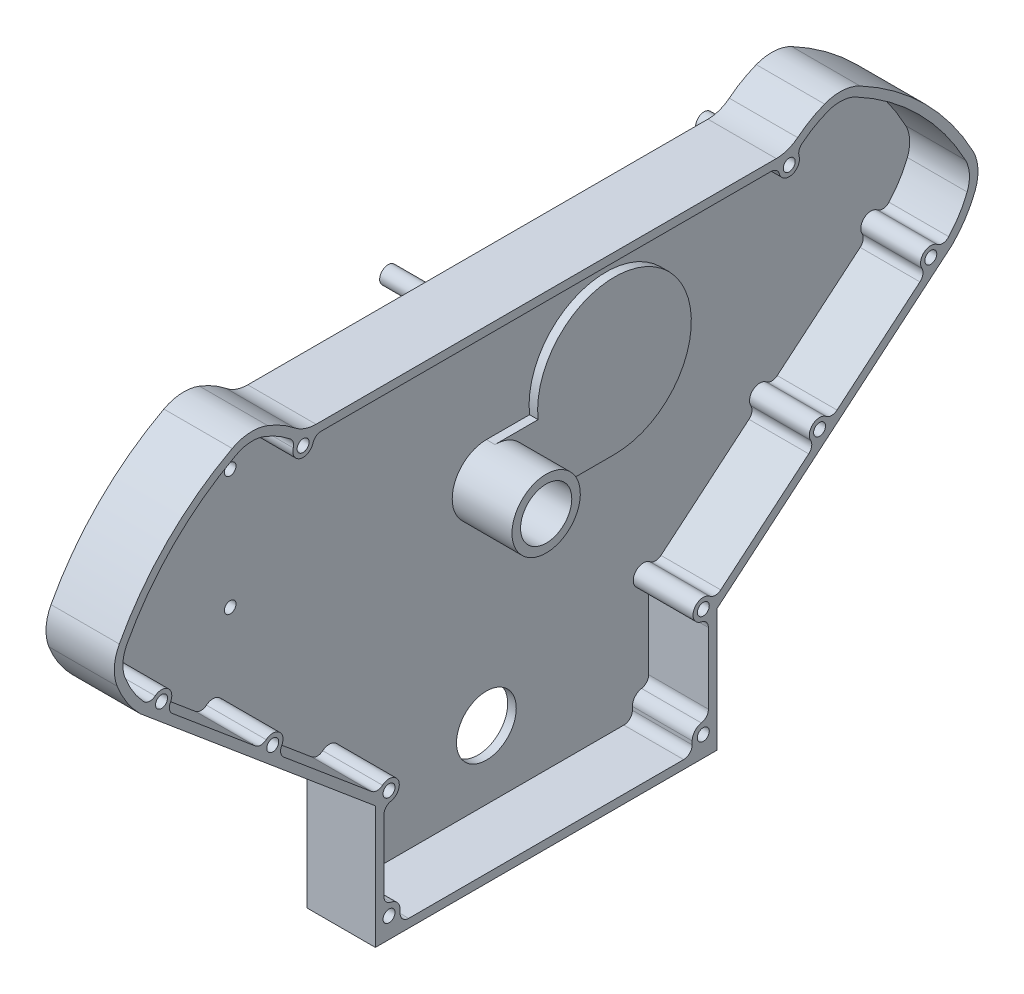
from build123d import *

# Parameters (mm, degrees)
BOSS_EXTRUDE1_DEPTH           = 20
BOSS_EXTRUDE1_DEPTH_BACK      = 20
SKETCH1_R                     = 15
FILLET2_R                     = 20
CUT_EXTRUDE3_DEPTH            = 5
SHELL1_START                  = -15
SHELL1_DEPTH                  = 35
SHELL1_START_2                = -10
SHELL1_2_DEPTH                = 30
SKETCH2_R                     = 17.5
CUT_EXTRUDE1_DEPTH            = 359.139425448
BOSS_EXTRUDE2_DEPTH           = 20
BOSS_EXTRUDE2_DEPTH_BACK      = 20
SKETCH4_R                     = 6
SKETCH4_R_2                   = 6.5
SKETCH5_R                     = 3.5
CUT_EXTRUDE2_DEPTH            = 360.810850393
FILLET3_R                     = 5
SKETCH9_R                     = 22.5
CUT_EXTRUDE5_DEPTH            = 2.5
SKETCH10_R                    = 3.5
BOSS_EXTRUDE3_DEPTH           = 37.5
FILLET4_R                     = 5
SKETCH11_R                    = 17.5
BOSS_EXTRUDE4_DEPTH           = 20
BOSS_EXTRUDE4_DRAFT           = 15
BOSS_EXTRUDE4_PROFILE_2_DEPTH = 20
BOSS_EXTRUDE4_PROFILE_2_DRAFT = 15
BOSS_EXTRUDE4_PROFILE_3_DEPTH = 20
BOSS_EXTRUDE4_PROFILE_3_DRAFT = 15
BOSS_EXTRUDE4_PROFILE_4_DEPTH = 20
BOSS_EXTRUDE4_PROFILE_4_DRAFT = 15
SKETCH12_R                    = 5
BOSS_EXTRUDE5_DEPTH           = 35
BOSS_EXTRUDE6_DEPTH           = 5
TAP_DRILL_FOR_M8_TAP1_D       = 6.8
TAP_DRILL_FOR_M8_TAP1_DEPTH   = 20
TAP_DRILL_FOR_M8_TAP1_TIP     = 2.042926105


# Read off the part's stored shape, not the designer's step: Shell1
with BuildPart() as part:
    # Sketch1 → Boss-Extrude1 (new, two sides: drawn at the far end of the back side and taken through both)
    with BuildSketch(Plane(origin=(0, 0, 0), x_dir=(0, 0, -1), z_dir=(1, 0, 0)).offset(-BOSS_EXTRUDE1_DEPTH_BACK)):
        with BuildLine():
            Line((-100, -45), (100, -45))
            Line((100, -45), (100, 26.817942396))
            Line((100, 26.817942396), (172.53405461, 87.681240867))
            Line((172.53405461, 87.681240867), (237.647832275, 142.31818769))
            ThreePointArc((237.647832275, 142.31818769), (245.477912651, 151.968299934), (251.152061969, 163.024468102))
            ThreePointArc((251.152061969, 163.024468102), (252.803738513, 173.555281136), (249.918352274, 183.816889432))
            ThreePointArc((249.918352274, 183.816889432), (221.802815136, 221.802815136), (183.816889432, 249.918352274))
            ThreePointArc((183.816889432, 249.918352274), (173.555281136, 252.803738513), (163.024468102, 251.152061969))
            ThreePointArc((163.024468102, 251.152061969), (151.968299934, 245.477912651), (142.31818769, 237.647832275))
            Line((142.31818769, 237.647832275), (-142.31818769, 237.647832275))
            ThreePointArc((-142.31818769, 237.647832275), (-151.968299934, 245.477912651), (-163.024468102, 251.152061969))
            ThreePointArc((-163.024468102, 251.152061969), (-173.555281136, 252.803738513), (-183.816889432, 249.918352274))
            ThreePointArc((-183.816889432, 249.918352274), (-221.802815136, 221.802815136), (-249.918352274, 183.816889432))
            ThreePointArc((-249.918352274, 183.816889432), (-252.803738513, 173.555281136), (-251.152061969, 163.024468102))
            ThreePointArc((-251.152061969, 163.024468102), (-245.477912651, 151.968299934), (-237.647832275, 142.31818769))
            Line((-237.647832275, 142.31818769), (-172.53405461, 87.681240867))
            Line((-172.53405461, 87.681240867), (-100, 26.817942396))
            Line((-100, 26.817942396), (-100, -45))
        make_face()
        with Locations((0, 125)):
            Circle(SKETCH1_R, mode=Mode.SUBTRACT)
    extrude(amount=BOSS_EXTRUDE1_DEPTH + BOSS_EXTRUDE1_DEPTH_BACK)

    # Fillet2
    fillet2_edges = [part.edges().sort_by_distance(p)[0] for p in [
        (0, 237.647832275, 142.31818769),
        (0, 237.647832275, -142.31818769),
    ]]
    fillet(fillet2_edges, radius=FILLET2_R)

    # Sketch6 → Cut-Extrude3 (cut)
    with BuildSketch(Plane.ZY.offset(20)):
        with BuildLine():
            Line((0, 110), (-70, 110))
            ThreePointArc((-70, 110), (-94.494897428, 181.622776602), (-31.270166538, 140))
            Line((-31.270166538, 140), (0, 140))
            ThreePointArc((0, 140), (15, 125), (0, 110))
        make_face()
    extrude(amount=-CUT_EXTRUDE3_DEPTH, mode=Mode.SUBTRACT)

    # Shell1 outline → Shell1 (cut)
    with BuildSketch(Plane.YZ.offset(SHELL1_START)):
        with BuildLine():
            ThreePointArc((181.468415704, 245.504207832), (173.259129067, 247.812516824), (164.83447864, 246.491175588))
            ThreePointArc((164.83447864, 246.491175588), (154.789156657, 241.348117675), (146.005028308, 234.263018692))
            Line((146.005028308, 234.263018692), (29.149480687, 95))
            Line((29.149480687, 95), (-40, 95))
            Line((-40, 95), (-40, -95))
            Line((-40, -95), (29.149480687, -95))
            Line((29.149480687, -95), (146.005028308, -234.263018692))
            ThreePointArc((146.005028308, -234.263018692), (154.789156657, -241.348117675), (164.83447864, -246.491175588))
            ThreePointArc((164.83447864, -246.491175588), (173.259129067, -247.812516824), (181.468415704, -245.504207832))
            ThreePointArc((181.468415704, -245.504207832), (218.26728123, -218.26728123), (245.504207832, -181.468415704))
            ThreePointArc((245.504207832, -181.468415704), (247.812516824, -173.259129067), (246.491175588, -164.83447864))
            ThreePointArc((246.491175588, -164.83447864), (242.869038207, -157.272699939), (238.139580127, -150.349362405))
            ThreePointArc((238.139580127, -150.349362405), (234.060692731, -143.000505321), (232.647832275, -134.715165971))
            Line((232.647832275, -134.715165971), (232.647832275, 134.715165971))
            ThreePointArc((232.647832275, 134.715165971), (234.060692731, 143.000505321), (238.139580127, 150.349362405))
            ThreePointArc((238.139580127, 150.349362405), (242.869038207, 157.272699939), (246.491175588, 164.83447864))
            ThreePointArc((246.491175588, 164.83447864), (247.812516824, 173.259129067), (245.504207832, 181.468415704))
            ThreePointArc((245.504207832, 181.468415704), (218.26728123, 218.26728123), (181.468415704, 245.504207832))
        make_face()
        with BuildLine():
            ThreePointArc((105, 0), (125, 20), (145, 0))
            Line((145, 0), (145, -25.27864045))
            ThreePointArc((145, -25.27864045), (183.541019662, -100), (105, -70))
            Line((105, -70), (105, 0))
        make_face(mode=Mode.SUBTRACT)
    extrude(amount=SHELL1_DEPTH, mode=Mode.SUBTRACT)

    # Shell1 2 outline → Shell1 2 (cut)
    with BuildSketch(Plane.YZ.offset(SHELL1_START_2)):
        with BuildLine():
            Line((145, -25.27864045), (145, 0))
            ThreePointArc((145, 0), (125, -20), (105, 0))
            Line((105, 0), (105, -70))
            ThreePointArc((105, -70), (183.541019662, -100), (145, -25.27864045))
        make_face()
    extrude(amount=SHELL1_2_DEPTH, mode=Mode.SUBTRACT)

    # Sketch2 → Cut-Extrude1 (cut, through all)
    with BuildSketch(Plane(origin=(0, 0, 0), x_dir=(0, 0, -1), z_dir=(1, 0, 0))):
        Circle(SKETCH2_R)
    extrude(amount=-CUT_EXTRUDE1_DEPTH, mode=Mode.SUBTRACT)

    # Sketch4 → Boss-Extrude2 (add, two sides: drawn at the far end of the back side and taken through both)
    with BuildSketch(Plane(origin=(0, 0, 0), x_dir=(0, 0, -1), z_dir=(1, 0, 0)).offset(-BOSS_EXTRUDE2_DEPTH_BACK)):
        with Locations((-160.088263995, 87.681240867)):
            Circle(SKETCH4_R)
        with Locations((-92, 30.548403662)):
            Circle(SKETCH4_R)
        with Locations((-92, -33)):
            Circle(SKETCH4_R_2)
        with Locations((92, -33)):
            Circle(SKETCH4_R_2)
        with Locations((92, 30.548403662)):
            Circle(SKETCH4_R)
        with Locations((160.088263995, 87.681240867)):
            Circle(SKETCH4_R)
        with Locations((225.20204166, 142.31818769)):
            Circle(SKETCH4_R)
        with Locations((-225.20204166, 142.31818769)):
            Circle(SKETCH4_R)
        with Locations((142.31818769, 230.647832275)):
            Circle(SKETCH4_R)
        with Locations((-142.31818769, 230.647832275)):
            Circle(SKETCH4_R)
    extrude(amount=BOSS_EXTRUDE2_DEPTH + BOSS_EXTRUDE2_DEPTH_BACK)

    # Sketch5 → Cut-Extrude2 (cut, through all)
    with BuildSketch(Plane.ZY.offset(20)):
        with Locations((-225.20204166, 142.31818769)):
            Circle(SKETCH5_R)
        with Locations((-160.088263995, 87.681240867)):
            Circle(SKETCH5_R)
        with Locations((-92, 30.548403662)):
            Circle(SKETCH5_R)
        with Locations((-92, -33)):
            Circle(SKETCH5_R)
        with Locations((92, -33)):
            Circle(SKETCH5_R)
        with Locations((92, 30.548403662)):
            Circle(SKETCH5_R)
        with Locations((160.088263995, 87.681240867)):
            Circle(SKETCH5_R)
        with Locations((225.20204166, 142.31818769)):
            Circle(SKETCH5_R)
        with Locations((142.31818769, 230.647832275)):
            Circle(SKETCH5_R)
        with Locations((-142.31818769, 230.647832275)):
            Circle(SKETCH5_R)
    extrude(amount=-CUT_EXTRUDE2_DEPTH, mode=Mode.SUBTRACT)

    # Fillet3
    fillet3_edges = [part.edges().sort_by_distance(p)[0] for p in [
        (2.5, 82.043085142, 158.036143135),
        (2.5, 88.723129933, 165.997110513),
        (2.5, 136.680031966, 223.1499208),
        (2.5, 143.360076756, 231.110888178),
        (2.5, 88.723129933, -165.997110513),
        (2.5, 82.043085142, -158.036143135),
        (2.5, 143.360076756, -231.110888178),
        (2.5, 136.680031966, -223.1499208),
        (2.5, 235.357646874, -146.035397187),
        (2.5, 232.725918089, -136.689550258),
        (2.5, 232.725918089, 136.689550258),
        (2.5, 235.357646874, 146.035397187),
        (2.5, -27.233718703, -95),
        (2.5, -27.233718703, 95),
        (2.5, 31.590292728, 97.908846518),
        (2.5, 25.352251239, 95),
        (2.5, 25.352251239, -95),
        (2.5, 31.590292727, -97.908846518),
    ]]
    fillet(fillet3_edges, radius=FILLET3_R)

    # Sketch9 → Cut-Extrude5 (cut)
    with BuildSketch(Plane.ZY.offset(20)):
        with BuildLine():
            Line((-101.971829482, 34.999540234), (-153.973160171, 78.633837636))
            ThreePointArc((-153.973160171, 78.633837636), (-155.033381436, 80.670503737), (-154.342930671, 82.860333794))
            ThreePointArc((-154.342930671, 82.860333794), (-155.267356922, 93.426574191), (-165.833597318, 92.50214794))
            ThreePointArc((-165.833597318, 92.50214794), (-167.870263419, 91.441926675), (-170.060093476, 92.132377439))
            Line((-170.060093476, 92.132377439), (-219.086937836, 133.270784459))
            ThreePointArc((-219.086937836, 133.270784459), (-220.147159101, 135.307450561), (-219.456708336, 137.497280618))
            ThreePointArc((-219.456708336, 137.497280618), (-220.280308318, 147.977387361), (-230.773338491, 147.339208664))
            ThreePointArc((-230.773338491, 147.339208664), (-232.972841055, 146.34775738), (-235.191109945, 147.296477731))
            ThreePointArc((-235.191109945, 147.296477731), (-241.579622159, 155.57518027), (-246.27834263, 164.917130279))
            ThreePointArc((-246.27834263, 164.917130279), (-247.584599559, 173.245605691), (-245.302642005, 181.361175886))
            ThreePointArc((-245.302642005, 181.361175886), (-218.105835943, 218.105835943), (-181.361175886, 245.302642005))
            ThreePointArc((-181.361175886, 245.302642005), (-173.245605691, 247.584599559), (-164.917130279, 246.27834263))
            ThreePointArc((-164.917130279, 246.27834263), (-157.386742324, 242.671241605), (-150.492145215, 237.961416633))
            ThreePointArc((-150.492145215, 237.961416633), (-150.236631035, 237.759339191), (-149.978528852, 237.560577897))
            ThreePointArc((-149.978528852, 237.560577897), (-148.877968919, 235.87856967), (-149.086308092, 233.879325154))
            ThreePointArc((-149.086308092, 233.879325154), (-144.399912096, 223.442527042), (-134.869516894, 229.771873734))
            ThreePointArc((-134.869516894, 229.771873734), (-133.883644541, 231.663269773), (-131.890048575, 232.421490318))
            Line((-131.890048575, 232.421490318), (131.890048575, 232.421490318))
            ThreePointArc((131.890048575, 232.421490318), (133.883644541, 231.663269773), (134.869516894, 229.771873734))
            ThreePointArc((134.869516894, 229.771873734), (144.399912096, 223.442527042), (149.086308092, 233.879325154))
            ThreePointArc((149.086308092, 233.879325154), (148.877968919, 235.87856967), (149.978528852, 237.560577897))
            ThreePointArc((149.978528852, 237.560577897), (150.236631035, 237.759339191), (150.492145215, 237.961416633))
            ThreePointArc((150.492145215, 237.961416633), (157.386742324, 242.671241605), (164.917130279, 246.27834263))
            ThreePointArc((164.917130279, 246.27834263), (173.245605691, 247.584599559), (181.361175886, 245.302642005))
            ThreePointArc((181.361175886, 245.302642005), (218.105835943, 218.105835943), (245.302642005, 181.361175886))
            ThreePointArc((245.302642005, 181.361175886), (247.584599559, 173.245605691), (246.27834263, 164.917130279))
            ThreePointArc((246.27834263, 164.917130279), (241.579622159, 155.57518027), (235.191109945, 147.296477731))
            ThreePointArc((235.191109945, 147.296477731), (232.972841055, 146.34775738), (230.773338491, 147.339208664))
            ThreePointArc((230.773338491, 147.339208664), (220.280308318, 147.977387361), (219.456708336, 137.497280618))
            ThreePointArc((219.456708336, 137.497280618), (220.147159101, 135.307450561), (219.086937836, 133.270784459))
            Line((219.086937836, 133.270784459), (170.060093476, 92.132377439))
            ThreePointArc((170.060093476, 92.132377439), (167.870263419, 91.441926675), (165.833597318, 92.50214794))
            ThreePointArc((165.833597318, 92.50214794), (155.267356922, 93.426574191), (154.342930671, 82.860333794))
            ThreePointArc((154.342930671, 82.860333794), (155.033381436, 80.670503737), (153.973160171, 78.633837636))
            Line((153.973160171, 78.633837636), (101.971829482, 34.999540234))
            ThreePointArc((101.971829482, 34.999540234), (99.781999425, 34.309089469), (97.745333323, 35.369310734))
            ThreePointArc((97.745333323, 35.369310734), (85.202691597, 33.718040625), (92, 23.048403662))
            ThreePointArc((92, 23.048403662), (94.121320344, 22.169724005), (95, 20.048403662))
            Line((95, 20.048403662), (95, -22.5))
            ThreePointArc((95, -22.5), (94.121320344, -24.621320344), (92, -25.5))
            ThreePointArc((92, -25.5), (85.768696326, -28.826170281), (85.064426543, -35.854438793))
            ThreePointArc((85.064426543, -35.854438793), (84.78271863, -38.665746198), (82.29019716, -39.996214311))
            Line((82.29019716, -39.996214311), (-82.29019716, -39.996214311))
            ThreePointArc((-82.29019716, -39.996214311), (-84.78271863, -38.665746198), (-85.064426543, -35.854438793))
            ThreePointArc((-85.064426543, -35.854438793), (-85.768696326, -28.826170281), (-92, -25.5))
            ThreePointArc((-92, -25.5), (-94.121320344, -24.621320344), (-95, -22.5))
            Line((-95, -22.5), (-95, 20.048403662))
            ThreePointArc((-95, 20.048403662), (-94.121320344, 22.169724005), (-92, 23.048403662))
            ThreePointArc((-92, 23.048403662), (-85.202691597, 33.718040625), (-97.745333323, 35.369310734))
            ThreePointArc((-97.745333323, 35.369310734), (-99.781999425, 34.309089469), (-101.971829482, 34.999540234))
        make_face()
        Circle(SKETCH9_R, mode=Mode.SUBTRACT)
    extrude(amount=-CUT_EXTRUDE5_DEPTH, mode=Mode.SUBTRACT)

    # Sketch10 → Boss-Extrude3 (add)
    # profile 1 of 2: a face of its own
    with BuildSketch(Plane(origin=(20, 0, 0), x_dir=(0, 0, -1), z_dir=(1, 0, 0))):
        with BuildLine():
            Line((-85.5, -33), (-85.5, -45))
            Line((-85.5, -45), (-98.5, -45))
            Line((-98.5, -45), (-98.5, -33))
            ThreePointArc((-98.5, -33), (-92, -26.5), (-85.5, -33))
        make_face()
        with Locations(Location((-92, -33, 0), (0, 0, 180))):
            Circle(SKETCH10_R, mode=Mode.SUBTRACT)
    # profile 2 of 2: a face of its own
    with BuildSketch(Plane(origin=(20, 0, 0), x_dir=(0, 0, -1), z_dir=(1, 0, 0))):
        with BuildLine():
            Line((98.5, -45), (98.5, -33))
            ThreePointArc((98.5, -33), (92, -26.5), (85.5, -33))
            Line((85.5, -33), (85.5, -45))
            Line((85.5, -45), (98.5, -45))
        make_face()
        with Locations(Location((92, -33, 0), (0, 0, 180))):
            Circle(SKETCH10_R, mode=Mode.SUBTRACT)
    extrude(amount=-BOSS_EXTRUDE3_DEPTH)

    # Fillet4
    fillet4_edges = [part.edges().sort_by_distance(p)[0] for p in [
        (2.5, -40, 85.5),
        (2.5, -40, -85.5),
    ]]
    fillet(fillet4_edges, radius=FILLET4_R)


with BuildPart() as boss_extrude4_tool:
    # Sketch11 → Boss-Extrude4 (with draft: the straight prism first)
    with BuildSketch(Plane.ZY.offset(17.5)):
        with Locations((-185, 185)):
            Circle(SKETCH11_R)
    extrude(amount=BOSS_EXTRUDE4_DEPTH)
    # Boss-Extrude4: the draft: its side faces are tilted about the plane it starts from
    boss_extrude4_sides = [boss_extrude4_tool.faces().sort_by_distance(p)[0] for p in [
        (-27.5, 185, -202.5),
    ]]
    draft(boss_extrude4_sides, Plane.ZY.offset(17.5), BOSS_EXTRUDE4_DRAFT)


with BuildPart() as part_1:
    add(part.part)

    # Boss-Extrude4: add boss_extrude4_tool
    add(boss_extrude4_tool.part)


with BuildPart() as boss_extrude4_profile_2_tool:
    # Sketch11 → Boss-Extrude4 profile 2 (with draft: the straight prism first)
    with BuildSketch(Plane.ZY.offset(17.5)):
        with Locations((100, 90)):
            Circle(SKETCH11_R)
    extrude(amount=BOSS_EXTRUDE4_PROFILE_2_DEPTH)
    # Boss-Extrude4 profile 2: the draft: its side faces are tilted about the plane it starts from
    boss_extrude4_profile_2_sides = [boss_extrude4_profile_2_tool.faces().sort_by_distance(p)[0] for p in [
        (-27.5, 90, 82.5),
    ]]
    draft(boss_extrude4_profile_2_sides, Plane.ZY.offset(17.5), BOSS_EXTRUDE4_PROFILE_2_DRAFT)


with BuildPart() as part_2:
    add(part_1.part)

    # Boss-Extrude4 profile 2: add boss_extrude4_profile_2_tool
    add(boss_extrude4_profile_2_tool.part)


with BuildPart() as boss_extrude4_profile_3_tool:
    # Sketch11 → Boss-Extrude4 profile 3 (with draft: the straight prism first)
    with BuildSketch(Plane.ZY.offset(17.5)):
        with Locations((-150, 120)):
            Circle(SKETCH11_R)
    extrude(amount=BOSS_EXTRUDE4_PROFILE_3_DEPTH)
    # Boss-Extrude4 profile 3: the draft: its side faces are tilted about the plane it starts from
    boss_extrude4_profile_3_sides = [boss_extrude4_profile_3_tool.faces().sort_by_distance(p)[0] for p in [
        (-27.5, 120, -167.5),
    ]]
    draft(boss_extrude4_profile_3_sides, Plane.ZY.offset(17.5), BOSS_EXTRUDE4_PROFILE_3_DRAFT)


with BuildPart() as part_3:
    add(part_2.part)

    # Boss-Extrude4 profile 3: add boss_extrude4_profile_3_tool
    add(boss_extrude4_profile_3_tool.part)


with BuildPart() as boss_extrude4_profile_4_tool:
    # Sketch11 → Boss-Extrude4 profile 4 (with draft: the straight prism first)
    with BuildSketch(Plane.ZY.offset(17.5)):
        with Locations((0, 200)):
            Circle(SKETCH11_R)
    extrude(amount=BOSS_EXTRUDE4_PROFILE_4_DEPTH)
    # Boss-Extrude4 profile 4: the draft: its side faces are tilted about the plane it starts from
    boss_extrude4_profile_4_sides = [boss_extrude4_profile_4_tool.faces().sort_by_distance(p)[0] for p in [
        (-27.5, 200, -17.5),
    ]]
    draft(boss_extrude4_profile_4_sides, Plane.ZY.offset(17.5), BOSS_EXTRUDE4_PROFILE_4_DRAFT)


with BuildPart() as part_4:
    add(part_3.part)

    # Boss-Extrude4 profile 4: add boss_extrude4_profile_4_tool
    add(boss_extrude4_profile_4_tool.part)

    # Sketch12 → Boss-Extrude5 (add)
    with BuildSketch(Plane.ZY.offset(37.5)):
        with Locations((-185, 185)):
            Circle(SKETCH12_R)
        with Locations((100, 90)):
            Circle(SKETCH12_R)
        with Locations((-150, 120)):
            Circle(SKETCH12_R)
        with Locations((0, 200)):
            Circle(SKETCH12_R)
    extrude(amount=BOSS_EXTRUDE5_DEPTH)

    # Sketch13 → Boss-Extrude6 (add)
    with BuildSketch(Plane.ZY.offset(17.5)):
        with BuildLine():
            ThreePointArc((160, 205), (150, 215), (140, 205))
            ThreePointArc((140, 205), (138.113384034, 195.8085497), (132.75862069, 188.103448276))
            ThreePointArc((132.75862069, 188.103448276), (125, 170), (132.75862069, 151.896551724))
            ThreePointArc((132.75862069, 151.896551724), (138.113384034, 144.1914503), (140, 135))
            ThreePointArc((140, 135), (150, 125), (160, 135))
            ThreePointArc((160, 135), (161.886615966, 144.1914503), (167.24137931, 151.896551724))
            ThreePointArc((167.24137931, 151.896551724), (175, 170), (167.24137931, 188.103448276))
            ThreePointArc((167.24137931, 188.103448276), (161.886615966, 195.8085497), (160, 205))
        make_face()
    extrude(amount=BOSS_EXTRUDE6_DEPTH)

    # Tap Drill for M8 Tap1
    with Locations(Plane.ZY.offset(22.5)):
        with Locations((150, 205), (150, 135)):
            Hole(TAP_DRILL_FOR_M8_TAP1_D / 2, depth=TAP_DRILL_FOR_M8_TAP1_DEPTH)
            with Locations((0, 0, -(TAP_DRILL_FOR_M8_TAP1_DEPTH + TAP_DRILL_FOR_M8_TAP1_TIP / 2))):  # 118° drill point
                Cone(0, TAP_DRILL_FOR_M8_TAP1_D / 2, TAP_DRILL_FOR_M8_TAP1_TIP, mode=Mode.SUBTRACT)


solid = part_4.part
